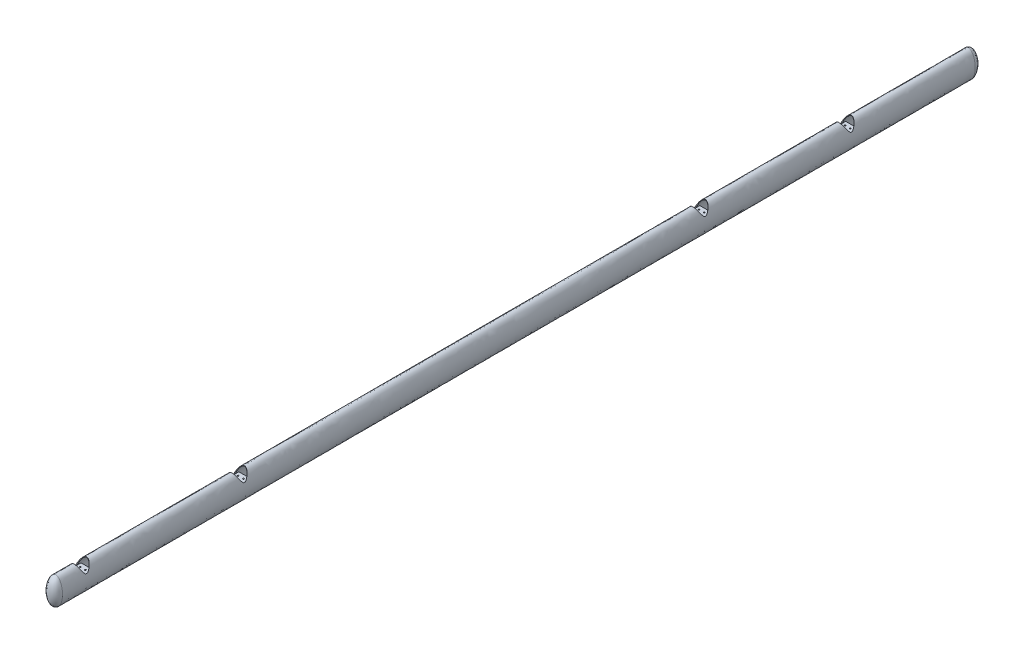
from build123d import *

# Parameters (mm, degrees)
SKETCH_1_RX                 = 30
SKETCH_1_RY                 = 15
SKETCH_1_RX_2               = 28.8
SKETCH_1_RY_2               = 13.8
EXTRUDE_1_DEPTH             = 2000
SKETCH_3_R                  = 13.85
CUT_EXTRUDE_1_DEPTH         = 18
EXTRUDE_2_REACH             = 2002.281
SKETCH_4_W                  = 28
SKETCH_4_H                  = 4
EXTRUDE_2_DIRECTION_2_REACH = 2002.281
SKETCH_6_R                  = 1.5
CUT_EXTRUDE_2_DEPTH         = 2016.913780538
REVOLVE_1_ANGLE             = 180
REVOLVE_2_ANGLE             = 180


with BuildPart() as part:
    # Эскиз1 → Бобышка-Вытянуть1 (new body)
    with BuildSketch(Plane.XY):
        with Locations(Location((234.287725543, 0), (0, 0, -90))):
            Ellipse(SKETCH_1_RX, SKETCH_1_RY)
        with Locations(Location((234.287725543, 0), (0, 0, 90))):
            Ellipse(SKETCH_1_RX_2, SKETCH_1_RY_2, mode=Mode.SUBTRACT)
    extrude(amount=EXTRUDE_1_DEPTH)

    # Эскиз3 → Вырез-Вытянуть1 (cut)
    with BuildSketch(Plane(origin=(0, 30, 0), x_dir=(1, 0, 0), z_dir=(0, 1, 0))):
        with Locations((-234.287725543, -1946)):
            Circle(SKETCH_3_R)
        with Locations((234.287725543, -270)):
            Circle(SKETCH_3_R)
        with Locations((234.287725543, -590)):
            Circle(SKETCH_3_R)
        with Locations((234.287725543, -1600)):
            Circle(SKETCH_3_R)
        with Locations((234.287725543, -1946)):
            Circle(SKETCH_3_R)
    extrude(amount=-CUT_EXTRUDE_1_DEPTH, mode=Mode.SUBTRACT)

    # Эскиз4 → Бобышка-Вытянуть2 (add, up to next)
    with BuildSketch(Plane(origin=(234.287726, 0, 0), x_dir=(0, 0, -1), z_dir=(1, 0, 0)), mode=Mode.PRIVATE) as extrude_2_sk1:
        with Locations((-1945.85, 10)):
            Rectangle(SKETCH_4_W, SKETCH_4_H)
    extrude_2_tool1 = extrude(extrude_2_sk1.sketch, amount=EXTRUDE_2_REACH, mode=Mode.PRIVATE) - part.part
    # Эскиз4 → Бобышка-Вытянуть2 (add, up to next)
    with BuildSketch(Plane(origin=(234.287726, 0, 0), x_dir=(0, 0, -1), z_dir=(1, 0, 0)), mode=Mode.PRIVATE) as extrude_2_sk2:
        with Locations((-1600.15, 10)):
            Rectangle(SKETCH_4_W, SKETCH_4_H)
    extrude_2_tool2 = extrude(extrude_2_sk2.sketch, amount=EXTRUDE_2_REACH, mode=Mode.PRIVATE) - part.part
    # Эскиз4 → Бобышка-Вытянуть2 (add, up to next)
    with BuildSketch(Plane(origin=(234.287726, 0, 0), x_dir=(0, 0, -1), z_dir=(1, 0, 0)), mode=Mode.PRIVATE) as extrude_2_sk3:
        with Locations((-589.85, 10)):
            Rectangle(SKETCH_4_W, SKETCH_4_H)
    extrude_2_tool3 = extrude(extrude_2_sk3.sketch, amount=EXTRUDE_2_REACH, mode=Mode.PRIVATE) - part.part
    # Эскиз4 → Бобышка-Вытянуть2 (add, up to next)
    with BuildSketch(Plane(origin=(234.287726, 0, 0), x_dir=(0, 0, -1), z_dir=(1, 0, 0)), mode=Mode.PRIVATE) as extrude_2_sk4:
        with Locations((-270.15, 10)):
            Rectangle(SKETCH_4_W, SKETCH_4_H)
    extrude_2_tool4 = extrude(extrude_2_sk4.sketch, amount=EXTRUDE_2_REACH, mode=Mode.PRIVATE) - part.part
    add(extrude_2_tool1.solids().sort_by_distance((234.287726, 10, 1945.85))[0])
    add(extrude_2_tool2.solids().sort_by_distance((234.287726, 10, 1600.15))[0])
    add(extrude_2_tool3.solids().sort_by_distance((234.287726, 10, 589.85))[0])
    add(extrude_2_tool4.solids().sort_by_distance((234.287726, 10, 270.15))[0])

    # Эскиз4 → Бобышка-Вытянуть2 direction 2 (add, up to next)
    with BuildSketch(Plane(origin=(234.287726, 0, 0), x_dir=(0, 0, -1), z_dir=(1, 0, 0)), mode=Mode.PRIVATE) as extrude_2_direction_2_sk1:
        with Locations((-1945.85, 10)):
            Rectangle(SKETCH_4_W, SKETCH_4_H)
    extrude_2_direction_2_tool1 = extrude(extrude_2_direction_2_sk1.sketch, amount=-EXTRUDE_2_DIRECTION_2_REACH, mode=Mode.PRIVATE) - part.part
    # Эскиз4 → Бобышка-Вытянуть2 direction 2 (add, up to next)
    with BuildSketch(Plane(origin=(234.287726, 0, 0), x_dir=(0, 0, -1), z_dir=(1, 0, 0)), mode=Mode.PRIVATE) as extrude_2_direction_2_sk2:
        with Locations((-1600.15, 10)):
            Rectangle(SKETCH_4_W, SKETCH_4_H)
    extrude_2_direction_2_tool2 = extrude(extrude_2_direction_2_sk2.sketch, amount=-EXTRUDE_2_DIRECTION_2_REACH, mode=Mode.PRIVATE) - part.part
    # Эскиз4 → Бобышка-Вытянуть2 direction 2 (add, up to next)
    with BuildSketch(Plane(origin=(234.287726, 0, 0), x_dir=(0, 0, -1), z_dir=(1, 0, 0)), mode=Mode.PRIVATE) as extrude_2_direction_2_sk3:
        with Locations((-589.85, 10)):
            Rectangle(SKETCH_4_W, SKETCH_4_H)
    extrude_2_direction_2_tool3 = extrude(extrude_2_direction_2_sk3.sketch, amount=-EXTRUDE_2_DIRECTION_2_REACH, mode=Mode.PRIVATE) - part.part
    # Эскиз4 → Бобышка-Вытянуть2 direction 2 (add, up to next)
    with BuildSketch(Plane(origin=(234.287726, 0, 0), x_dir=(0, 0, -1), z_dir=(1, 0, 0)), mode=Mode.PRIVATE) as extrude_2_direction_2_sk4:
        with Locations((-270.15, 10)):
            Rectangle(SKETCH_4_W, SKETCH_4_H)
    extrude_2_direction_2_tool4 = extrude(extrude_2_direction_2_sk4.sketch, amount=-EXTRUDE_2_DIRECTION_2_REACH, mode=Mode.PRIVATE) - part.part
    add(extrude_2_direction_2_tool1.solids().sort_by_distance((234.287726, 10, 1945.85))[0])
    add(extrude_2_direction_2_tool2.solids().sort_by_distance((234.287726, 10, 1600.15))[0])
    add(extrude_2_direction_2_tool3.solids().sort_by_distance((234.287726, 10, 589.85))[0])
    add(extrude_2_direction_2_tool4.solids().sort_by_distance((234.287726, 10, 270.15))[0])

    # Эскиз6 → Вырез-Вытянуть2 (cut, through all)
    with BuildSketch(Plane(origin=(0, 12, 0), x_dir=(1, 0, 0), z_dir=(0, 1, 0))):
        with Locations((228.630871293, -1940.343145751)):
            Circle(SKETCH_6_R)
        with Locations((239.944579792, -1940.343145751)):
            Circle(SKETCH_6_R)
        with Locations((228.630871293, -1951.656854249)):
            Circle(SKETCH_6_R)
        with Locations((239.944579792, -1951.656854249)):
            Circle(SKETCH_6_R)
        with Locations((228.630871293, -1594.343145751)):
            Circle(SKETCH_6_R)
        with Locations((239.944579792, -1594.343145751)):
            Circle(SKETCH_6_R)
        with Locations((228.630871293, -1605.656854249)):
            Circle(SKETCH_6_R)
        with Locations((239.944579792, -1605.656854249)):
            Circle(SKETCH_6_R)
        with Locations((228.630871293, -584.343145751)):
            Circle(SKETCH_6_R)
        with Locations((239.944579792, -584.343145751)):
            Circle(SKETCH_6_R)
        with Locations((228.630871293, -595.656854249)):
            Circle(SKETCH_6_R)
        with Locations((239.944579792, -595.656854249)):
            Circle(SKETCH_6_R)
        with Locations((228.630871293, -264.343145751)):
            Circle(SKETCH_6_R)
        with Locations((239.944579792, -264.343145751)):
            Circle(SKETCH_6_R)
        with Locations((228.630871293, -275.656854249)):
            Circle(SKETCH_6_R)
        with Locations((239.944579792, -275.656854249)):
            Circle(SKETCH_6_R)
    extrude(amount=-CUT_EXTRUDE_2_DEPTH, mode=Mode.SUBTRACT)

    # Эскиз7 → Повернуть1 (revolve)
    with BuildSketch(Plane.XY.offset(2000)):
        with BuildLine():
            Line((234.287726, 30), (234.287726, 28.8))
            add(Edge.make_bspline(
                [(234.287726, -28.8), (248.087725543, -28.8), (248.087725543, 0), (248.087725543, 28.8), (234.287726, 28.8)],
                knots=[3.141592654, 3.141592654, 3.141592654, 4.71238898, 4.71238898, 6.283185307, 6.283185307, 6.283185307], degree=2, weights=[1, 0.707106781, 1, 0.707106781, 1]))
            Line((234.287726, -28.8), (234.287726, -30))
            add(Edge.make_bspline(
                [(234.287726, -30), (249.287725543, -30), (249.287725543, 0), (249.287725543, 30), (234.287726, 30)],
                knots=[3.141592654, 3.141592654, 3.141592654, 4.71238898, 4.71238898, 6.283185307, 6.283185307, 6.283185307], degree=2, weights=[1, 0.707106781, 1, 0.707106781, 1]))
        make_face()
    revolve(axis=Axis((234.287726, 30, 2000), (0, -1, 0)), revolution_arc=REVOLVE_1_ANGLE)

    # Эскиз8 → Повернуть2 (revolve)
    with BuildSketch(Plane(origin=(0, 0, 0), x_dir=(-1, 0, 0), z_dir=(0, 0, -1))):
        with BuildLine():
            Line((-234.287726, 30), (-234.287726, 28.8))
            add(Edge.make_bspline(
                [(-234.287726, -28.8), (-220.487725543, -28.8), (-220.487725543, 0), (-220.487725543, 28.8), (-234.287726, 28.8)],
                knots=[3.141592654, 3.141592654, 3.141592654, 4.71238898, 4.71238898, 6.283185307, 6.283185307, 6.283185307], degree=2, weights=[1, 0.707106781, 1, 0.707106781, 1]))
            Line((-234.287726, -28.8), (-234.287726, -30))
            add(Edge.make_bspline(
                [(-234.287726, -30), (-219.287725543, -30), (-219.287725543, 0), (-219.287725543, 30), (-234.287726, 30)],
                knots=[3.141592654, 3.141592654, 3.141592654, 4.71238898, 4.71238898, 6.283185307, 6.283185307, 6.283185307], degree=2, weights=[1, 0.707106781, 1, 0.707106781, 1]))
        make_face()
    revolve(axis=Axis((234.287726, 30, 0), (0, -1, 0)), revolution_arc=REVOLVE_2_ANGLE)


solid = part.part
